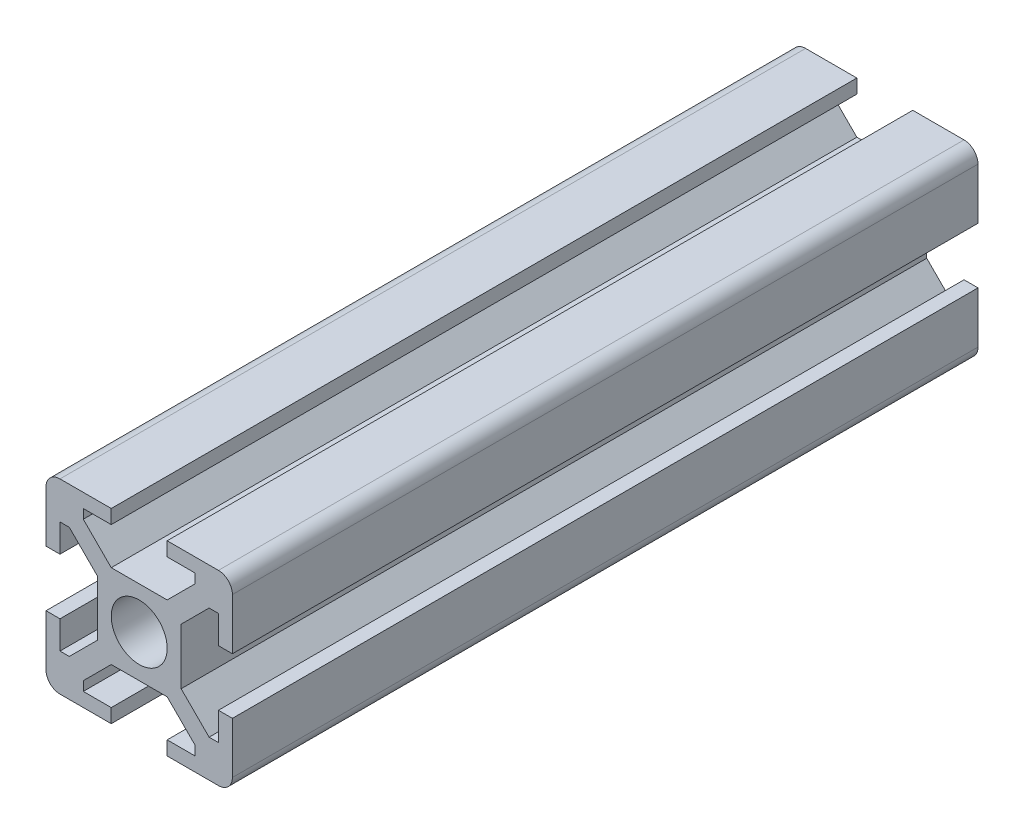
from build123d import *

# Parameters (mm, degrees)
ESQUISSE1_W                  = 20
ESQUISSE1_H                  = 20
EXTRUSION1_DEPTH             = 40
CONG_1_R                     = 1.5
ENL_V_MAT_EXTRU_1_DEPTH      = 82.240384046
R_P_TITION_CIRCULAIRE1_COUNT = 4


with BuildPart() as part:
    # Esquisse1 → Extrusion1 (new, symmetric)
    with BuildSketch(Plane.XY):
        Rectangle(ESQUISSE1_W, ESQUISSE1_H)
    extrude(amount=EXTRUSION1_DEPTH, both=True)

    # Congé1
    cong_1_edges = [part.edges().sort_by_distance(p)[0] for p in [
        (-10, -10, 0),
        (10, -10, 0),
        (-10, 10, 0),
        (10, 10, 0),
    ]]
    fillet(cong_1_edges, radius=CONG_1_R)

    # Esquisse2 → Enlèv. mat.-Extru.1 (cut, through all)
    with BuildSketch(Plane(origin=(0, 0, -40), x_dir=(-1, 0, 0), z_dir=(0, 0, -1))):
        Polygon((-10, 3), (-10, -3), (-8.5, -3), (-8.5, -6), (-7.5, -6), (-4.5, -3), (-4.5, 3), (-7.5, 6), (-8.5, 6), (-8.5, 3), align=None)
    enl_v_mat_extru_1 = extrude(amount=-ENL_V_MAT_EXTRU_1_DEPTH, mode=Mode.SUBTRACT)

    # Répétition circulaire1: Enlèv. mat.-Extru.1 ×4 about axis
    r_p_tition_circulaire1_axis = Axis((0, 0, 9.333809512), (0, 0, -1))
    for i in range(1, R_P_TITION_CIRCULAIRE1_COUNT):
        add(enl_v_mat_extru_1.rotate(r_p_tition_circulaire1_axis, i * 360 / R_P_TITION_CIRCULAIRE1_COUNT), mode=Mode.SUBTRACT)

    # Esquisse5 → Trou taraudé M6x1.01 (revolve, cut)
    with BuildSketch(Plane(origin=(0, 0, -40), x_dir=(0, 1, 0), z_dir=(1, 0, 0))):
        Polygon((0, 0), (0, 31.502151548), (2.5, 30), (2.5, 24), (3, 24), (3, 0), align=None)
    trou_taraud_m6x1_01 = revolve(axis=Axis((0, 0, -46.35), (0, 0, 1)), mode=Mode.SUBTRACT)

    # Symétrie1: Trou taraudé M6x1.01 across plane
    add(trou_taraud_m6x1_01.mirror(Plane.XY), mode=Mode.SUBTRACT)


solid = part.part
